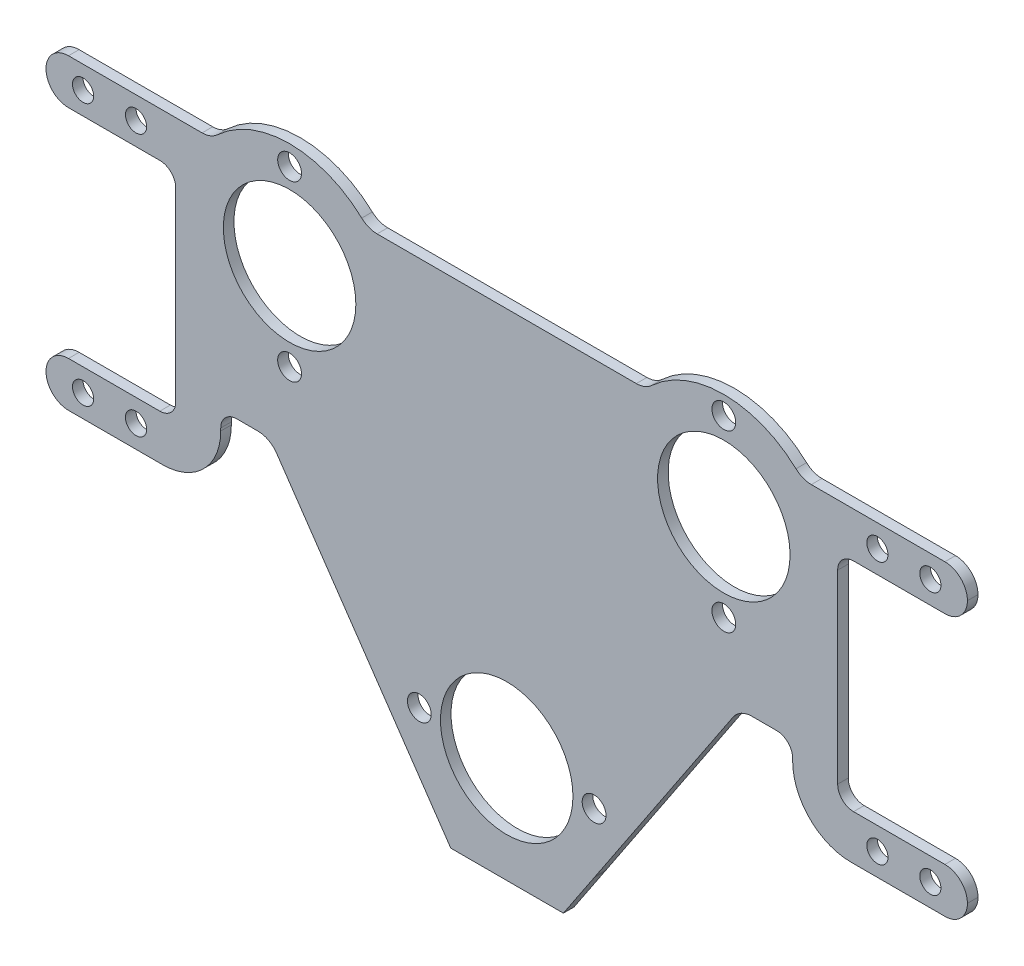
from build123d import *

# Parameters (mm, degrees)
SKETCH1_R           = 2
SKETCH1_R_2         = 12.51
BOSS_EXTRUDE1_DEPTH = 2
FILLET1_R           = 3
FILLET2_R           = 4.25
FILLET3_R           = 11
CUT_EXTRUDE1_REACH  = 104.947
SKETCH2_R           = 2.25


with BuildPart() as part:
    # Sketch1 → Boss-Extrude1 (new body)
    with BuildSketch(Plane.XY):
        with BuildLine():
            Line((44.023434797, -5), (54, -5))
            Line((54, -5), (54, -19.5))
            Line((54, -19.5), (87, -19.5))
            Line((87, -19.5), (87, -11))
            Line((87, -11), (62.5, -11))
            Line((62.5, -11), (62.5, 30))
            Line((62.5, 30), (87, 30))
            Line((87, 30), (87, 38.5))
            Line((87, 38.5), (55.756354563, 38.5))
            ThreePointArc((55.756354563, 38.5), (41, 45), (26.243645437, 38.5))
            Line((26.243645437, 38.5), (-26.243645437, 38.5))
            ThreePointArc((-26.243645437, 38.5), (-41, 45), (-55.756354563, 38.5))
            Line((-55.756354563, 38.5), (-87, 38.5))
            Line((-87, 38.5), (-87, 30))
            Line((-87, 30), (-62.5, 30))
            Line((-62.5, 30), (-62.5, -11))
            Line((-62.5, -11), (-87, -11))
            Line((-87, -11), (-87, -19.5))
            Line((-87, -19.5), (-54, -19.5))
            Line((-54, -19.5), (-54, -5))
            Line((-54, -5), (-44.723496399, -5))
            Line((-44.723496399, -5), (-10.556829732, -55))
            Line((-10.556829732, -55), (10.704632705, -55))
            Line((10.704632705, -55), (16.51289283, -46.283810101))
            ThreePointArc((16.51289283, -46.283810101), (16.643237983, -46.09065505), (16.771323869, -45.895994479))
            Line((16.771323869, -45.895994479), (44.023434797, -5))
        make_face()
        with Locations((-80, -15.25)):
            Circle(SKETCH1_R, mode=Mode.SUBTRACT)
        with Locations((-70, -15.25)):
            Circle(SKETCH1_R, mode=Mode.SUBTRACT)
        with Locations((0, -35)):
            Circle(SKETCH1_R_2, mode=Mode.SUBTRACT)
        with Locations((70, -15.25)):
            Circle(SKETCH1_R, mode=Mode.SUBTRACT)
        with Locations((80, -15.25)):
            Circle(SKETCH1_R, mode=Mode.SUBTRACT)
        with Locations((-80, 34.25)):
            Circle(SKETCH1_R, mode=Mode.SUBTRACT)
        with Locations((-70, 34.25)):
            Circle(SKETCH1_R, mode=Mode.SUBTRACT)
        with Locations((-41, 25)):
            Circle(SKETCH1_R_2, mode=Mode.SUBTRACT)
        with Locations((41, 25)):
            Circle(SKETCH1_R_2, mode=Mode.SUBTRACT)
        with Locations((70, 34.25)):
            Circle(SKETCH1_R, mode=Mode.SUBTRACT)
        with Locations((80, 34.25)):
            Circle(SKETCH1_R, mode=Mode.SUBTRACT)
    extrude(amount=BOSS_EXTRUDE1_DEPTH)

    # Fillet1
    fillet1_edges = [part.edges().sort_by_distance(p)[0] for p in [
        (62.5, 30, 1),
        (62.5, -11, 1),
        (54, -5, 1),
        (-54, -5, 1),
        (-62.5, -11, 1),
        (-62.5, 30, 1),
    ]]
    fillet(fillet1_edges, radius=FILLET1_R)

    # Fillet2
    fillet2_edges = [part.edges().sort_by_distance(p)[0] for p in [
        (87, 30, 1),
        (87, 38.5, 1),
        (87, -11, 1),
        (87, -19.5, 1),
        (-87, -19.5, 1),
        (-87, -11, 1),
        (-87, 30, 1),
        (-87, 38.5, 1),
        (26.243645437, 38.5, 1),
        (55.756354563, 38.5, 1),
        (-55.756354563, 38.5, 1),
        (-26.243645437, 38.5, 1),
        (44.023434797, -5, 1),
        (-44.723496399, -5, 1),
    ]]
    fillet(fillet2_edges, radius=FILLET2_R - 0.0001)  # a hair under: the kernel refuses the full size

    # Fillet3
    fillet3_edges = [part.edges().sort_by_distance(p)[0] for p in [
        (54, -19.5, 1),
        (-54, -19.5, 1),
    ]]
    fillet(fillet3_edges, radius=FILLET3_R)

    # Sketch2 → Cut-Extrude1 (cut, up to next)
    with BuildSketch(Plane.XY.offset(2), mode=Mode.PRIVATE) as cut_extrude1_sk1:
        with Locations((-41, 41.25)):
            Circle(SKETCH2_R)
    cut_extrude1_tool1 = extrude(cut_extrude1_sk1.sketch, amount=-CUT_EXTRUDE1_REACH, mode=Mode.PRIVATE) & part.part
    # Sketch2 → Cut-Extrude1 (cut, up to next)
    with BuildSketch(Plane.XY.offset(2), mode=Mode.PRIVATE) as cut_extrude1_sk2:
        with Locations((-41, 8.5)):
            Circle(SKETCH2_R)
    cut_extrude1_tool2 = extrude(cut_extrude1_sk2.sketch, amount=-CUT_EXTRUDE1_REACH, mode=Mode.PRIVATE) & part.part
    # Sketch2 → Cut-Extrude1 (cut, up to next)
    with BuildSketch(Plane.XY.offset(2), mode=Mode.PRIVATE) as cut_extrude1_sk3:
        with Locations((41, 8.5)):
            Circle(SKETCH2_R)
    cut_extrude1_tool3 = extrude(cut_extrude1_sk3.sketch, amount=-CUT_EXTRUDE1_REACH, mode=Mode.PRIVATE) & part.part
    # Sketch2 → Cut-Extrude1 (cut, up to next)
    with BuildSketch(Plane.XY.offset(2), mode=Mode.PRIVATE) as cut_extrude1_sk4:
        with Locations((41, 41.5)):
            Circle(SKETCH2_R)
    cut_extrude1_tool4 = extrude(cut_extrude1_sk4.sketch, amount=-CUT_EXTRUDE1_REACH, mode=Mode.PRIVATE) & part.part
    # Sketch2 → Cut-Extrude1 (cut, up to next)
    with BuildSketch(Plane.XY.offset(2), mode=Mode.PRIVATE) as cut_extrude1_sk5:
        with Locations((-16.5, -35)):
            Circle(SKETCH2_R)
    cut_extrude1_tool5 = extrude(cut_extrude1_sk5.sketch, amount=-CUT_EXTRUDE1_REACH, mode=Mode.PRIVATE) & part.part
    # Sketch2 → Cut-Extrude1 (cut, up to next)
    with BuildSketch(Plane.XY.offset(2), mode=Mode.PRIVATE) as cut_extrude1_sk6:
        with Locations((16.5, -35)):
            Circle(SKETCH2_R)
    cut_extrude1_tool6 = extrude(cut_extrude1_sk6.sketch, amount=-CUT_EXTRUDE1_REACH, mode=Mode.PRIVATE) & part.part
    add(cut_extrude1_tool1.solids().sort_by_distance((-41, 41.25, 2))[0], mode=Mode.SUBTRACT)
    add(cut_extrude1_tool2.solids().sort_by_distance((-41, 8.5, 2))[0], mode=Mode.SUBTRACT)
    add(cut_extrude1_tool3.solids().sort_by_distance((41, 8.5, 2))[0], mode=Mode.SUBTRACT)
    add(cut_extrude1_tool4.solids().sort_by_distance((41, 41.5, 2))[0], mode=Mode.SUBTRACT)
    add(cut_extrude1_tool5.solids().sort_by_distance((-16.5, -35, 2))[0], mode=Mode.SUBTRACT)
    add(cut_extrude1_tool6.solids().sort_by_distance((16.5, -35, 2))[0], mode=Mode.SUBTRACT)


solid = part.part
